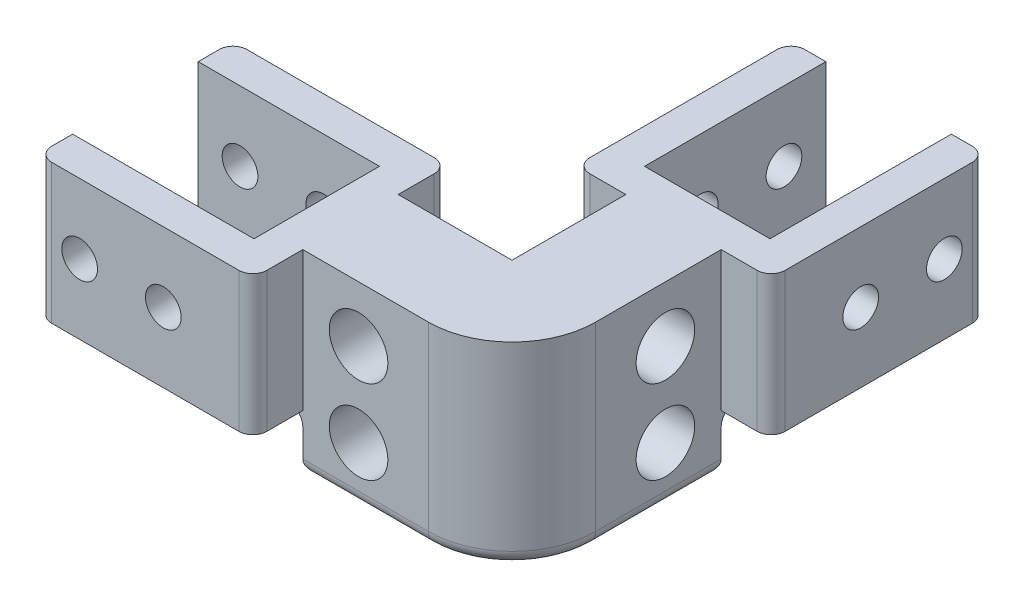
from build123d import *

# Parameters (mm, degrees)
EXTRUDE_1_DEPTH      = 25
CUT_EXTRUDE_1_REACH  = 113.383
SKETCH_2_R           = 3.2
CUT_EXTRUDE_2_REACH  = 113.383
SKETCH_3_R           = 3.2
SKETCH_14_W          = 22.5
SKETCH_14_H          = 2.5
SKETCH_14_W_2        = 2.5
SKETCH_14_H_2        = 22.5
CUT_EXTRUDE_12_DEPTH = 25
SKETCH_5_W           = 20.4
SKETCH_5_H           = 20.4
CUT_EXTRUDE_7_DEPTH  = 25
EXTRUDE_2_DEPTH      = 10
SKETCH_10_R          = 3.2
CUT_EXTRUDE_8_DEPTH  = 17.1
SKETCH_11_R          = 5.25
CUT_EXTRUDE_9_DEPTH  = 12.1
SKETCH_12_R          = 3.2
CUT_EXTRUDE_10_DEPTH = 17.1
SKETCH_13_R          = 5.25
CUT_EXTRUDE_11_DEPTH = 12.1
FILLET_2_R           = 2.5
FILLET_3_R           = 15
FILLET_5_R           = 2.5


with BuildPart() as part:
    # 스케치1 → 보스-돌출1 (new body)
    with BuildSketch(Plane(origin=(0, 0, 0), x_dir=(1, 0, 0), z_dir=(0, 1, 0))):
        Polygon((-17.5, 67.5), (-11.25, 67.5), (-11.25, 37.5), (11.25, 37.5), (11.25, 67.5), (17.5, 67.5), (17.5, -17.5), (-67.5, -17.5), (-67.5, -11.25), (-37.5, -11.25), (-37.5, 11.25), (-67.5, 11.25), (-67.5, 17.5), (-17.5, 17.5), align=None)
    extrude(amount=EXTRUDE_1_DEPTH)

    # 컷-돌출1: up to this face of the body (flat: up to its plane)
    cut_extrude_1_end = Plane(part.part.faces().sort_by_distance((-17.5, 12.5, -42.5))[0])
    # 스케치2 → 컷-돌출1 (cut, up to the picked face)
    with BuildSketch(Plane(origin=(17.5, 0, 0), x_dir=(0, 0, -1), z_dir=(1, 0, 0)), mode=Mode.PRIVATE) as cut_extrude_1_sk1:
        with Locations((60, 12.5)):
            Circle(SKETCH_2_R)
    cut_extrude_1_tool1 = split(extrude(cut_extrude_1_sk1.sketch, amount=-CUT_EXTRUDE_1_REACH, mode=Mode.PRIVATE), bisect_by=cut_extrude_1_end, keep=Keep.BOTH, mode=Mode.PRIVATE)
    # 스케치2 → 컷-돌출1 (cut, up to the picked face)
    with BuildSketch(Plane(origin=(17.5, 0, 0), x_dir=(0, 0, -1), z_dir=(1, 0, 0)), mode=Mode.PRIVATE) as cut_extrude_1_sk2:
        with Locations((45, 12.5)):
            Circle(SKETCH_2_R)
    cut_extrude_1_tool2 = split(extrude(cut_extrude_1_sk2.sketch, amount=-CUT_EXTRUDE_1_REACH, mode=Mode.PRIVATE), bisect_by=cut_extrude_1_end, keep=Keep.BOTH, mode=Mode.PRIVATE)
    add(cut_extrude_1_tool1.solids().sort_by(Axis((17.5, 12.5, -60), (-1, 0, 0)))[0], mode=Mode.SUBTRACT)
    add(cut_extrude_1_tool2.solids().sort_by(Axis((17.5, 12.5, -45), (-1, 0, 0)))[0], mode=Mode.SUBTRACT)

    # 컷-돌출2: up to this face of the body (flat: up to its plane)
    cut_extrude_2_end = Plane(part.part.faces().sort_by_distance((-42.5, 12.5, -17.5))[0])
    # 스케치3 → 컷-돌출2 (cut, up to the picked face)
    with BuildSketch(Plane.XY.offset(17.5), mode=Mode.PRIVATE) as cut_extrude_2_sk1:
        with Locations((-60, 12.5)):
            Circle(SKETCH_3_R)
    cut_extrude_2_tool1 = split(extrude(cut_extrude_2_sk1.sketch, amount=-CUT_EXTRUDE_2_REACH, mode=Mode.PRIVATE), bisect_by=cut_extrude_2_end, keep=Keep.BOTH, mode=Mode.PRIVATE)
    # 스케치3 → 컷-돌출2 (cut, up to the picked face)
    with BuildSketch(Plane.XY.offset(17.5), mode=Mode.PRIVATE) as cut_extrude_2_sk2:
        with Locations((-45, 12.5)):
            Circle(SKETCH_3_R)
    cut_extrude_2_tool2 = split(extrude(cut_extrude_2_sk2.sketch, amount=-CUT_EXTRUDE_2_REACH, mode=Mode.PRIVATE), bisect_by=cut_extrude_2_end, keep=Keep.BOTH, mode=Mode.PRIVATE)
    add(cut_extrude_2_tool1.solids().sort_by(Axis((-60, 12.5, 17.5), (0, 0, -1)))[0], mode=Mode.SUBTRACT)
    add(cut_extrude_2_tool2.solids().sort_by(Axis((-45, 12.5, 17.5), (0, 0, -1)))[0], mode=Mode.SUBTRACT)

    # 스케치14 → 컷-돌출12 (cut)
    with BuildSketch(Plane(origin=(0, 25, 0), x_dir=(1, 0, 0), z_dir=(0, 1, 0))):
        with Locations((0, 36.25)):
            Rectangle(SKETCH_14_W, SKETCH_14_H)
        with Locations((-36.25, 0)):
            Rectangle(SKETCH_14_W_2, SKETCH_14_H_2)
    extrude(amount=-CUT_EXTRUDE_12_DEPTH, mode=Mode.SUBTRACT)

    # 스케치5 → 컷-돌출7 (cut)
    with BuildSketch(Plane(origin=(0, 25, 0), x_dir=(1, 0, 0), z_dir=(0, 1, 0))):
        with Locations((-18.75, 18.75)):
            Rectangle(SKETCH_5_W, SKETCH_5_H)
        Polygon((-28.95, -8.55), (-28.95, -17.5), (17.5, -17.5), (17.5, 28.95), (8.55, 28.95), (8.55, -8.55), align=None)
    extrude(amount=-CUT_EXTRUDE_7_DEPTH, mode=Mode.SUBTRACT)

    # 스케치15 → 보스-돌출2 (add)
    with BuildSketch(Plane.XZ):
        Polygon((8.55, 8.55), (8.55, -28.95), (-8.55, -28.95), (-8.55, -8.55), (-28.95, -8.55), (-28.95, 8.55), align=None)
    extrude(amount=EXTRUDE_2_DEPTH)

    # 스케치10 → 컷-돌출8 (cut)
    with BuildSketch(Plane.XY.offset(8.55)):
        with Locations((-18.95, 15)):
            Circle(SKETCH_10_R)
        with Locations((-18.95, 0)):
            Circle(SKETCH_10_R)
    extrude(amount=-CUT_EXTRUDE_8_DEPTH, mode=Mode.SUBTRACT)

    # 스케치11 → 컷-돌출9 (cut)
    with BuildSketch(Plane.XY.offset(8.55)):
        with Locations((-18.95, 15)):
            Circle(SKETCH_11_R)
        with Locations((-18.95, 0)):
            Circle(SKETCH_11_R)
    extrude(amount=-CUT_EXTRUDE_9_DEPTH, mode=Mode.SUBTRACT)

    # 스케치12 → 컷-돌출10 (cut)
    with BuildSketch(Plane(origin=(8.55, 0, 0), x_dir=(0, 0, -1), z_dir=(1, 0, 0))):
        with Locations((18.95, 15)):
            Circle(SKETCH_12_R)
        with Locations((18.95, 0)):
            Circle(SKETCH_12_R)
    extrude(amount=-CUT_EXTRUDE_10_DEPTH, mode=Mode.SUBTRACT)

    # 스케치13 → 컷-돌출11 (cut)
    with BuildSketch(Plane(origin=(8.55, 0, 0), x_dir=(0, 0, -1), z_dir=(1, 0, 0))):
        with Locations((18.95, 15)):
            Circle(SKETCH_13_R)
        with Locations((18.95, 0)):
            Circle(SKETCH_13_R)
    extrude(amount=-CUT_EXTRUDE_11_DEPTH, mode=Mode.SUBTRACT)

    # 필렛2
    fillet_2_edges = [part.edges().sort_by_distance(p)[0] for p in [
        (-17.5, 12.5, -28.95),
        (-28.95, 12.5, -17.5),
        (-28.95, 12.5, 17.5),
        (17.5, 12.5, -28.95),
        (-10.2, -10, 8.55),
        (-28.95, -10, 0),
        (0, -10, -28.95),
        (8.55, -10, -10.2),
        (-17.5, 12.5, -67.5),
        (17.5, 12.5, -67.5),
        (-67.5, 12.5, 17.5),
        (-67.5, 12.5, -17.5),
    ]]
    fillet(fillet_2_edges, radius=FILLET_2_R)

    # 필렛3
    # the kernel refuses this fillet: 15 mm, written as the material it takes off along each edge
    with BuildSketch(Plane(origin=(-6.45, -10, -6.45), x_dir=(1, 0, 0), z_dir=(0, 0, -1))) as fillet_3_piece_1:
        with BuildLine():
            CenterArc((12.5, -2.5), 2.5, 0, 90)
            Line((15, -2.5), (15, 0))
            Line((15, 0), (12.5, 0))
        make_face()
    revolve(axis=Axis((-6.45, -10, -6.45), (0, -1, 0)), revolution_arc=90, mode=Mode.SUBTRACT)
    with BuildSketch(Plane(origin=(8.55, -10, 8.55), x_dir=(0, 0, -1), z_dir=(0, 1, 0))) as fillet_3_piece_2:
        with BuildLine():
            CenterArc((FILLET_3_R, FILLET_3_R), FILLET_3_R, 180, 90)
            Line((0, FILLET_3_R), (0, 0))
            Line((0, 0), (FILLET_3_R, 0))
        make_face()
    extrude(amount=72.5, mode=Mode.SUBTRACT)

    # 필렛5
    fillet_5_edges = [part.edges().sort_by_distance(p)[0] for p in [
        (-28.95, 0, 0),
        (0, 0, -28.95),
    ]]
    fillet(fillet_5_edges, radius=FILLET_5_R)


solid = part.part
